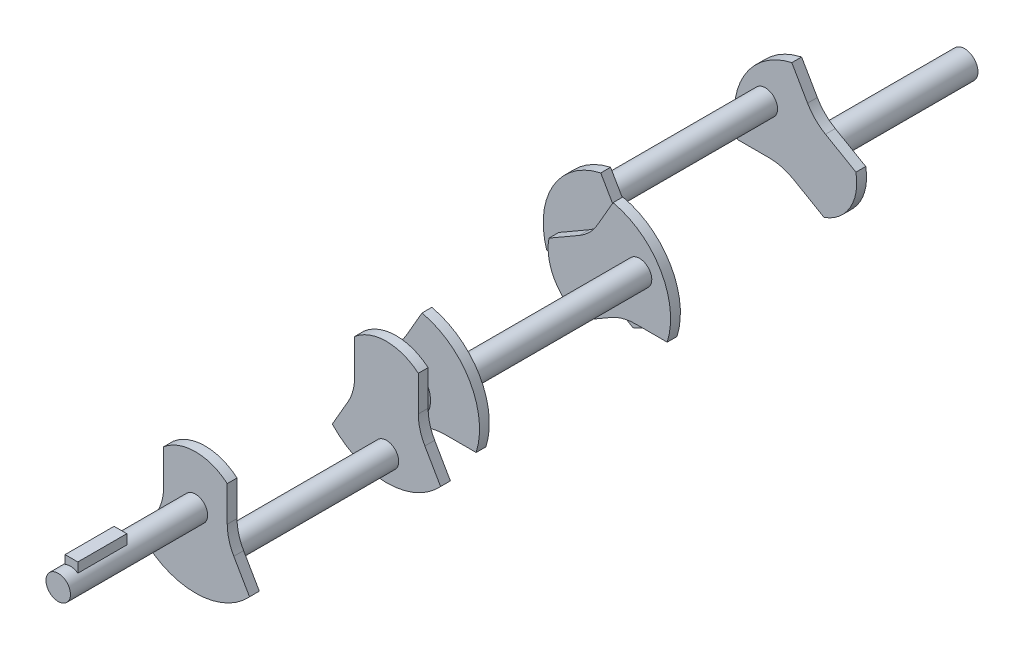
from build123d import *

# Parameters (mm, degrees)
BOSS_EXTRUDE1_DEPTH    = 5.08
SKETCH2_R              = 6.35
BOSS_EXTRUDE2_DEPTH    = 76.2
BOSS_EXTRUDE3_START    = 44.45
SKETCH3_W              = 6.604
SKETCH3_H              = 6.975666606
BOSS_EXTRUDE3_DEPTH    = 25.4
SKETCH4_R              = 6.35
BOSS_EXTRUDE4_DEPTH    = 93.98
LPATTERN1_COUNT        = 2
LPATTERN1_PITCH        = 99.06
SKETCH5_R              = 12.7
BOSS_EXTRUDE5_DEPTH    = 5.08
LPATTERN2_COUNT        = 2
LPATTERN2_PITCH        = 109.22
LPATTERN2_COPY_1_DEPTH = 5.08
MOVE_START             = -208.28
MOVE_FACE1_DEPTH       = 104.14
MOVE_START_2           = -203.2
MOVE_FACE1_2_DEPTH     = 93.98
MOVE_FACE1_3_OUTLINE_R = 6.35
MOVE_FACE1_3_DEPTH     = 104.14
MOVE_FACE1_4_DEPTH     = 5.08
MOVE_START_3           = -109.22
MOVE_FACE1_5_DEPTH     = 5.08
LPATTERN3_COUNT        = 2
LPATTERN3_PITCH        = 218.44
LPATTERN3_COPY_1_DEPTH = 5.08
MOVE_START_4           = -317.5
MOVE_FACE2_DEPTH       = 104.14
MOVE_START_5           = -312.42
MOVE_FACE2_2_DEPTH     = 93.98
MOVE_FACE2_3_OUTLINE_R = 6.35
MOVE_FACE2_3_DEPTH     = 104.14
MOVE_FACE2_4_DEPTH     = 5.08
MOVE_START_6           = -218.44
MOVE_FACE2_5_DEPTH     = 5.08
SKETCH6_R              = 6.985
BOSS_EXTRUDE6_DEPTH    = 76.2


# Read off the part's stored shape, not the designer's step: Move Face1, Move Face2
with BuildPart() as part:
    # Sketch1 → Boss-Extrude1 (new body)
    with BuildSketch(Plane.XY):
        with BuildLine():
            Line((28.071212152, -25.760765678), (19.912954744, -11.630249345))
            ThreePointArc((19.912954744, -11.630249345), (17.375484012, -5.504253091), (16.51, 1.069750655))
            Line((16.51, 1.069750655), (16.51, 19.302328875))
            ThreePointArc((16.51, 19.302328875), (0, 25.4), (-16.51, 19.302328875))
            Line((-16.51, 19.302328875), (-16.51, 1.069750655))
            ThreePointArc((-16.51, 1.069750655), (-17.375484012, -5.504253091), (-19.912954744, -11.630249345))
            Line((-19.912954744, -11.630249345), (-28.071212152, -25.760765678))
            ThreePointArc((-28.071212152, -25.760765678), (0, -38.1), (28.071212152, -25.760765678))
        make_face()
    boss_extrude1 = extrude(amount=BOSS_EXTRUDE1_DEPTH)

    # Sketch2 → Boss-Extrude2 (add)
    with BuildSketch(Plane.XY):
        with Locations(Location((0, 0, 0), (0, 0, 180))):
            Circle(SKETCH2_R)
    extrude(amount=BOSS_EXTRUDE2_DEPTH)

    # Sketch3 → Boss-Extrude3 (add)
    with BuildSketch(Plane.XY.offset(BOSS_EXTRUDE3_START)):
        with Locations((0.504239379, 6.672166697)):
            Rectangle(SKETCH3_W, SKETCH3_H)
    extrude(amount=BOSS_EXTRUDE3_DEPTH)

    # Sketch4 → Boss-Extrude4 (add)
    with BuildSketch(Plane(origin=(0, 0, 0), x_dir=(-1, 0, 0), z_dir=(0, 0, -1))):
        with Locations(Location((0, -25.4, 0), (0, 0, 180))):
            Circle(SKETCH4_R)
    boss_extrude4 = extrude(amount=BOSS_EXTRUDE4_DEPTH)

    # LPattern1: Boss-Extrude1 ×2
    with Locations(*[(0, 0, -i * LPATTERN1_PITCH) for i in range(1, LPATTERN1_COUNT)]):
        add(boss_extrude1)

    # Sketch5 → Boss-Extrude5 (add)
    with BuildSketch(Plane(origin=(0, 0, -99.06), x_dir=(-1, 0, 0), z_dir=(0, 0, -1))):
        with Locations(Location((0, 0, 0), (0, 0, 180))):
            Circle(SKETCH5_R)
    boss_extrude5 = extrude(amount=BOSS_EXTRUDE5_DEPTH)

    # LPattern2: Boss-Extrude1, Boss-Extrude4, Boss-Extrude5 ×2
    with Locations(*[(0, 0, -i * LPATTERN2_PITCH) for i in range(1, LPATTERN2_COUNT)]):
        add(boss_extrude1)
        add(boss_extrude4)
        add(boss_extrude5)

    # LPattern2 copy 1 sketch → LPattern2 copy 1 (add)
    with BuildSketch(Plane.XY.offset(-208.28)):
        with BuildLine():
            Line((28.071212152, -25.760765678), (19.912954744, -11.630249345))
            ThreePointArc((19.912954744, -11.630249345), (17.375484012, -5.504253091), (16.51, 1.069750655))
            Line((16.51, 1.069750655), (16.51, 19.302328875))
            ThreePointArc((16.51, 19.302328875), (0, 25.4), (-16.51, 19.302328875))
            Line((-16.51, 19.302328875), (-16.51, 1.069750655))
            ThreePointArc((-16.51, 1.069750655), (-17.375484012, -5.504253091), (-19.912954744, -11.630249345))
            Line((-19.912954744, -11.630249345), (-28.071212152, -25.760765678))
            ThreePointArc((-28.071212152, -25.760765678), (0, -38.1), (28.071212152, -25.760765678))
        make_face()
    extrude(amount=LPATTERN2_COPY_1_DEPTH)

    # Move Face1 outline → Move Face1 (cut)
    with BuildSketch(Plane.XY.offset(MOVE_START)):
        with BuildLine():
            Line((0.115614013, 23.060249345), (1.442792283, 25.358989539))
            ThreePointArc((1.442792283, 25.358989539), (-8.119480999, 24.067281282), (-16.51, 19.302328875))
            Line((-16.51, 19.302328875), (-16.51, 9.532052944))
            Line((-16.51, 9.532052944), (-9.181431243, 13.763204089))
            ThreePointArc((-9.181431243, 13.763204089), (-3.920919001, 17.799737103), (0.115614013, 23.060249345))
        make_face()
        with BuildLine():
            ThreePointArc((19.912954744, -11.630249345), (19.855820207, -11.530771305), (19.79913554, -11.431036234))
            ThreePointArc((19.79913554, -11.431036234), (13.343823196, -12.325425391), (7.328568757, -14.832954744))
            Line((7.328568757, -14.832954744), (-8.461307158, -23.949243854))
            ThreePointArc((-8.461307158, -23.949243854), (-15.673074402, -19.987864788), (-21.240133013, -13.928989539))
            Line((-21.240133013, -13.928989539), (-28.071212152, -25.760765678))
            ThreePointArc((-28.071212152, -25.760765678), (0, -38.1), (28.071212152, -25.760765678))
            Line((28.071212152, -25.760765678), (19.912954744, -11.630249345))
        make_face()
    extrude(amount=MOVE_FACE1_DEPTH, mode=Mode.SUBTRACT)

    # Move Face1 2 outline → Move Face1 2 (cut)
    with BuildSketch(Plane.XY.offset(MOVE_START_2)):
        with BuildLine():
            Line((-5.511396499, -22.246112141), (0.024351243, -19.050046692))
            ThreePointArc((0.024351243, -19.050046692), (-3.175, -19.900738686), (-5.511396499, -22.246112141))
        make_face()
    extrude(amount=MOVE_FACE1_2_DEPTH, mode=Mode.SUBTRACT)

    # Move Face1 3 outline → Move Face1 3 (add)
    with BuildSketch(Plane.XY.offset(MOVE_START)):
        with Locations((21.997045256, 12.7)):
            Circle(MOVE_FACE1_3_OUTLINE_R)
    extrude(amount=MOVE_FACE1_3_DEPTH)

    # Move Face1 4 outline → Move Face1 4 (add)
    with BuildSketch(Plane.XY.offset(MOVE_START)):
        with BuildLine():
            ThreePointArc((36.345083574, -11.43), (32.995567884, 19.05), (8.273871422, 37.190765678))
            Line((8.273871422, 37.190765678), (1.442792283, 25.358989539))
            ThreePointArc((1.442792283, 25.358989539), (9.473461473, 23.567212981), (16.51, 19.302328875))
            Line((16.51, 19.302328875), (16.51, 15.89606545))
            ThreePointArc((16.51, 15.89606545), (28.347045256, 12.7), (16.51, 9.50393455))
            Line((16.51, 9.50393455), (16.51, 1.069750655))
            ThreePointArc((16.51, 1.069750655), (17.346043099, -5.393377176), (19.79913554, -11.431036234))
            ThreePointArc((19.79913554, -11.431036234), (19.913850979, -11.43025906), (20.028568757, -11.43))
            Line((20.028568757, -11.43), (36.345083574, -11.43))
        make_face()
        with BuildLine():
            Line((-16.51, 1.069750655), (-16.51, 9.532052944))
            Line((-16.51, 9.532052944), (-24.971307158, 4.646914979))
            ThreePointArc((-24.971307158, 4.646914979), (-24.90261749, -5.00196383), (-21.240133013, -13.928989539))
            Line((-21.240133013, -13.928989539), (-19.912954744, -11.630249345))
            ThreePointArc((-19.912954744, -11.630249345), (-17.375484012, -5.504253091), (-16.51, 1.069750655))
        make_face()
    extrude(amount=MOVE_FACE1_4_DEPTH)

    # Move Face1 5 outline → Move Face1 5 (add)
    with BuildSketch(Plane.XY.offset(MOVE_START_3)):
        with BuildLine():
            ThreePointArc((36.345083574, -11.43), (32.995567884, 19.05), (8.273871422, 37.190765678))
            Line((8.273871422, 37.190765678), (1.442792283, 25.358989539))
            ThreePointArc((1.442792283, 25.358989539), (9.473461473, 23.567212981), (16.51, 19.302328875))
            Line((16.51, 19.302328875), (16.51, 15.89606545))
            ThreePointArc((16.51, 15.89606545), (28.347045256, 12.7), (16.51, 9.50393455))
            Line((16.51, 9.50393455), (16.51, 1.069750655))
            ThreePointArc((16.51, 1.069750655), (17.346043099, -5.393377176), (19.79913554, -11.431036234))
            ThreePointArc((19.79913554, -11.431036234), (19.913850979, -11.43025906), (20.028568757, -11.43))
            Line((20.028568757, -11.43), (36.345083574, -11.43))
        make_face()
        with BuildLine():
            Line((-16.51, 1.069750655), (-16.51, 9.532052944))
            Line((-16.51, 9.532052944), (-24.971307158, 4.646914979))
            ThreePointArc((-24.971307158, 4.646914979), (-24.90261749, -5.00196383), (-21.240133013, -13.928989539))
            Line((-21.240133013, -13.928989539), (-19.912954744, -11.630249345))
            ThreePointArc((-19.912954744, -11.630249345), (-17.375484012, -5.504253091), (-16.51, 1.069750655))
        make_face()
    extrude(amount=MOVE_FACE1_5_DEPTH)

    # LPattern3: Boss-Extrude1, Boss-Extrude4 ×2
    with Locations(*[(0, 0, -i * LPATTERN3_PITCH) for i in range(1, LPATTERN3_COUNT)]):
        add(boss_extrude1)
        add(boss_extrude4)

    # LPattern3 copy 1 sketch → LPattern3 copy 1 (add)
    with BuildSketch(Plane.XY.offset(-317.5)):
        with BuildLine():
            Line((28.071212152, -25.760765678), (19.912954744, -11.630249345))
            ThreePointArc((19.912954744, -11.630249345), (17.375484012, -5.504253091), (16.51, 1.069750655))
            Line((16.51, 1.069750655), (16.51, 19.302328875))
            ThreePointArc((16.51, 19.302328875), (0, 25.4), (-16.51, 19.302328875))
            Line((-16.51, 19.302328875), (-16.51, 1.069750655))
            ThreePointArc((-16.51, 1.069750655), (-17.375484012, -5.504253091), (-19.912954744, -11.630249345))
            Line((-19.912954744, -11.630249345), (-28.071212152, -25.760765678))
            ThreePointArc((-28.071212152, -25.760765678), (0, -38.1), (28.071212152, -25.760765678))
        make_face()
    extrude(amount=LPATTERN3_COPY_1_DEPTH)

    # Move Face2 outline → Move Face2 (cut)
    with BuildSketch(Plane.XY.offset(MOVE_START_4)):
        with BuildLine():
            ThreePointArc((16.51, 19.302328875), (8.119480999, 24.067281282), (-1.442792283, 25.358989539))
            Line((-1.442792283, 25.358989539), (-0.115614013, 23.060249345))
            ThreePointArc((-0.115614013, 23.060249345), (3.920919001, 17.799737103), (9.181431243, 13.763204089))
            Line((9.181431243, 13.763204089), (16.51, 9.532052944))
            Line((16.51, 9.532052944), (16.51, 19.302328875))
        make_face()
        with BuildLine():
            ThreePointArc((-7.328568757, -14.832954744), (-13.343823196, -12.325425391), (-19.79913554, -11.431036234))
            ThreePointArc((-19.79913554, -11.431036234), (-19.855820207, -11.530771305), (-19.912954744, -11.630249345))
            Line((-19.912954744, -11.630249345), (-28.071212152, -25.760765678))
            ThreePointArc((-28.071212152, -25.760765678), (0, -38.1), (28.071212152, -25.760765678))
            Line((28.071212152, -25.760765678), (21.240133013, -13.928989539))
            ThreePointArc((21.240133013, -13.928989539), (15.673074402, -19.987864788), (8.461307158, -23.949243854))
            Line((8.461307158, -23.949243854), (-7.328568757, -14.832954744))
        make_face()
    extrude(amount=MOVE_FACE2_DEPTH, mode=Mode.SUBTRACT)

    # Move Face2 2 outline → Move Face2 2 (cut)
    with BuildSketch(Plane.XY.offset(MOVE_START_5)):
        with BuildLine():
            ThreePointArc((5.511396499, -22.246112141), (3.175, -19.900738686), (-0.024351243, -19.050046692))
            Line((-0.024351243, -19.050046692), (5.511396499, -22.246112141))
        make_face()
    extrude(amount=MOVE_FACE2_2_DEPTH, mode=Mode.SUBTRACT)

    # Move Face2 3 outline → Move Face2 3 (add)
    with BuildSketch(Plane.XY.offset(MOVE_START_4)):
        with Locations((-21.997045256, 12.7)):
            Circle(MOVE_FACE2_3_OUTLINE_R)
    extrude(amount=MOVE_FACE2_3_DEPTH)

    # Move Face2 4 outline → Move Face2 4 (add)
    with BuildSketch(Plane.XY.offset(MOVE_START_4)):
        with BuildLine():
            ThreePointArc((-8.273871422, 37.190765678), (-32.995567884, 19.05), (-36.345083574, -11.43))
            Line((-36.345083574, -11.43), (-20.028568757, -11.43))
            ThreePointArc((-20.028568757, -11.43), (-19.913850979, -11.43025906), (-19.79913554, -11.431036234))
            ThreePointArc((-19.79913554, -11.431036234), (-17.346043099, -5.393377176), (-16.51, 1.069750655))
            Line((-16.51, 1.069750655), (-16.51, 9.50393455))
            ThreePointArc((-16.51, 9.50393455), (-28.347045256, 12.7), (-16.51, 15.89606545))
            Line((-16.51, 15.89606545), (-16.51, 19.302328875))
            ThreePointArc((-16.51, 19.302328875), (-9.473461473, 23.567212981), (-1.442792283, 25.358989539))
            Line((-1.442792283, 25.358989539), (-8.273871422, 37.190765678))
        make_face()
        with BuildLine():
            Line((24.971307158, 4.646914979), (16.51, 9.532052944))
            Line((16.51, 9.532052944), (16.51, 1.069750655))
            ThreePointArc((16.51, 1.069750655), (17.375484012, -5.504253091), (19.912954744, -11.630249345))
            Line((19.912954744, -11.630249345), (21.240133013, -13.928989539))
            ThreePointArc((21.240133013, -13.928989539), (24.90261749, -5.00196383), (24.971307158, 4.646914979))
        make_face()
    extrude(amount=MOVE_FACE2_4_DEPTH)

    # Move Face2 5 outline → Move Face2 5 (add)
    with BuildSketch(Plane.XY.offset(MOVE_START_6)):
        with BuildLine():
            ThreePointArc((-8.273871422, 37.190765678), (-32.995567884, 19.05), (-36.345083574, -11.43))
            Line((-36.345083574, -11.43), (-20.028568757, -11.43))
            ThreePointArc((-20.028568757, -11.43), (-19.913850979, -11.43025906), (-19.79913554, -11.431036234))
            ThreePointArc((-19.79913554, -11.431036234), (-17.346043099, -5.393377176), (-16.51, 1.069750655))
            Line((-16.51, 1.069750655), (-16.51, 9.50393455))
            ThreePointArc((-16.51, 9.50393455), (-28.347045256, 12.7), (-16.51, 15.89606545))
            Line((-16.51, 15.89606545), (-16.51, 19.302328875))
            ThreePointArc((-16.51, 19.302328875), (-9.473461473, 23.567212981), (-1.442792283, 25.358989539))
            Line((-1.442792283, 25.358989539), (-8.273871422, 37.190765678))
        make_face()
        with BuildLine():
            Line((24.971307158, 4.646914979), (16.51, 9.532052944))
            Line((16.51, 9.532052944), (16.51, 1.069750655))
            ThreePointArc((16.51, 1.069750655), (17.375484012, -5.504253091), (19.912954744, -11.630249345))
            Line((19.912954744, -11.630249345), (21.240133013, -13.928989539))
            ThreePointArc((21.240133013, -13.928989539), (24.90261749, -5.00196383), (24.971307158, 4.646914979))
        make_face()
    extrude(amount=MOVE_FACE2_5_DEPTH)

    # Sketch6 → Boss-Extrude6 (add)
    with BuildSketch(Plane(origin=(0, 0, -317.5), x_dir=(-1, 0, 0), z_dir=(0, 0, -1))):
        with Locations(Location((0, 0, 0), (0, 0, 180))):
            Circle(SKETCH6_R)
    extrude(amount=BOSS_EXTRUDE6_DEPTH)


solid = part.part
